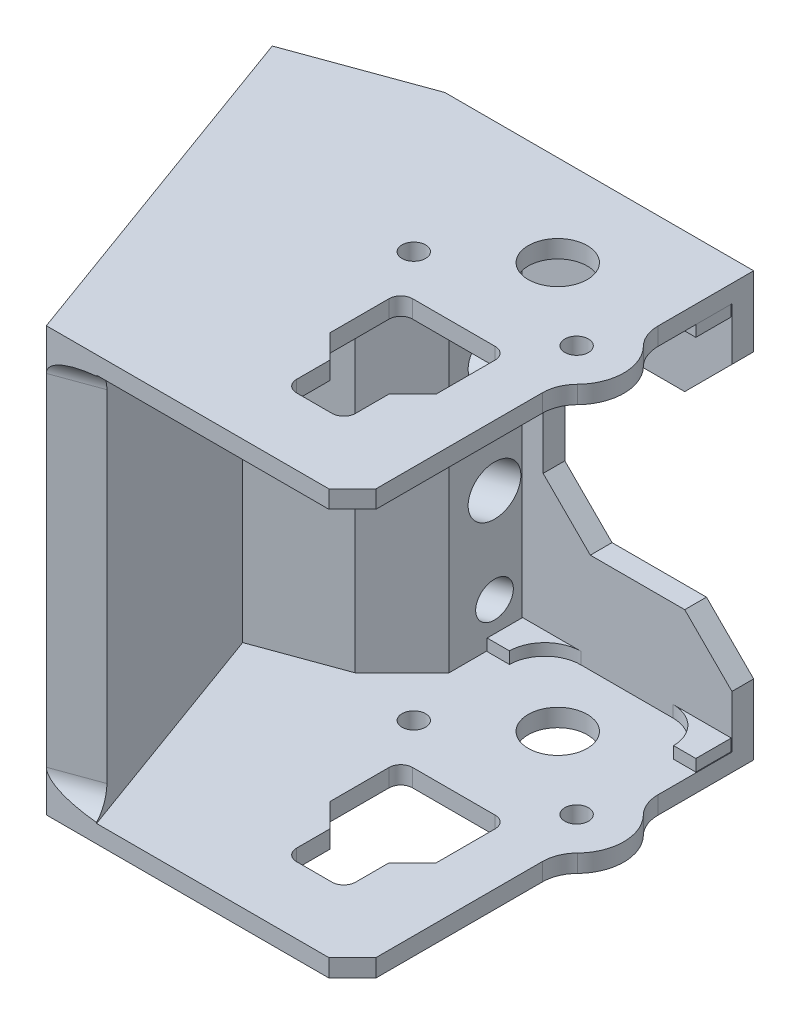
from build123d import *

# Parameters (mm, degrees)
SKETCH1_W                  = 17.8
SKETCH1_H                  = 30
SKETCH1_R                  = 1
SKETCH1_R_2                = 2.5
BOSS_EXTRUDE1_DEPTH        = 1.5
SKETCH2_W                  = 9
SKETCH2_H                  = 6
SKETCH2_W_2                = 5
SKETCH2_H_2                = 5.830943002
CUT_EXTRUDE1_DEPTH         = 20.247337478
CHAMFER1_SIZE              = 2
FILLET1_R                  = 1
BOSS_EXTRUDE2_DEPTH        = 1
SKETCH4_W                  = 12
SKETCH4_H                  = 17.95
BOSS_EXTRUDE3_DEPTH        = 4
BOSS_EXTRUDE4_DEPTH        = 35.9
SKETCH6_W                  = 12.770133269
SKETCH6_H                  = 35.9
BOSS_EXTRUDE5_DEPTH        = 11.41
F_3_0_MM_DOWEL_HOLES1_D    = 3
F_4_2_4_2_DIAMETER_HOLE1_D = 4.2
SKETCH12_W                 = 17.8
SKETCH12_H                 = 1.5
BOSS_EXTRUDE6_DEPTH        = 4
CHAMFER2_SIZE              = 2
SKETCH13_W                 = 26.167642811
SKETCH13_H                 = 35.9
BOSS_EXTRUDE7_DEPTH        = 1.840000002
CHAMFER3_SIZE              = 4
CHAMFER4_SIZE              = 4
SKETCH14_W                 = 16
SKETCH14_H                 = 8
CUT_EXTRUDE2_DEPTH         = 56.735892419
CHAMFER5_SIZE              = 4
BOSS_EXTRUDE8_DEPTH        = 1.5
BOSS_EXTRUDE9_START        = -34.4
BOSS_EXTRUDE9_DEPTH        = 1.5
FILLET2_R                  = 3
BOSS_EXTRUDE10_START       = -1.5
BOSS_EXTRUDE10_DEPTH       = 1.5
BOSS_EXTRUDE11_START       = -35.9
BOSS_EXTRUDE11_DEPTH       = 1.5
SKETCH18_W                 = 19.259010622
SKETCH18_H                 = 32.9
BOSS_EXTRUDE12_DEPTH       = 4
FILLET3_R                  = 2


# Some blends are built 0.0001 mm under size
with BuildPart() as part:
    # Sketch1 → Boss-Extrude1 (new body)
    with BuildSketch(Plane(origin=(0, 0, 0), x_dir=(1, 0, 0), z_dir=(0, 1, 0))):
        with Locations((0, -2)):
            Rectangle(SKETCH1_W, SKETCH1_H)
        with Locations(Location((-6.9, 0, 0), (0, 0, 270))):
            Circle(SKETCH1_R, mode=Mode.SUBTRACT)
        with Locations(Location((6.9, 0, 0), (0, 0, 270))):
            Circle(SKETCH1_R, mode=Mode.SUBTRACT)
        with Locations(Location((0, 5.3, 0), (0, 0, 270))):
            Circle(SKETCH1_R_2, mode=Mode.SUBTRACT)
    extrude(amount=BOSS_EXTRUDE1_DEPTH)

    # Sketch2 → Cut-Extrude1 (cut, through all)
    with BuildSketch(Plane(origin=(0, 1.5, 0), x_dir=(1, 0, 0), z_dir=(0, 1, 0))):
        with Locations((0, -6.5)):
            Rectangle(SKETCH2_W, SKETCH2_H)
        with Locations((0, -12.415471501)):
            Rectangle(SKETCH2_W_2, SKETCH2_H_2)
    extrude(amount=-CUT_EXTRUDE1_DEPTH, mode=Mode.SUBTRACT)

    # Chamfer1
    chamfer1_edges = [part.edges().sort_by_distance(p)[0] for p in [
        (2.5, 0.75, 9.5),
        (-2.5, 0.75, 9.5),
    ]]
    chamfer(chamfer1_edges, length=CHAMFER1_SIZE - 0.0001)  # a hair under: the kernel refuses the full size

    # Fillet1
    fillet1_edges = [part.edges().sort_by_distance(p)[0] for p in [
        (4.5, 0.75, 3.5),
        (2.5, 0.75, 15.330943002),
        (-2.5, 0.75, 15.330943002),
        (-4.5, 0.75, 3.5),
    ]]
    fillet(fillet1_edges, radius=FILLET1_R)

    # Sketch3 → Boss-Extrude2 (add)
    with BuildSketch(Plane(origin=(0, 1.5, 0), x_dir=(1, 0, 0), z_dir=(0, 1, 0))):
        with BuildLine():
            Line((8.84, 8.16), (6.959390471, 8.16))
            ThreePointArc((6.959390471, 8.16), (6.042112051, 10.284532913), (3.900010938, 11.159999998))
            Line((3.900010938, 11.159999998), (-3.900010938, 11.159999998))
            ThreePointArc((-3.900010938, 11.159999998), (-6.04211205, 10.284532912), (-6.959390471, 8.16))
            Line((-6.959390471, 8.16), (-8.84, 8.16))
            Line((-8.84, 8.16), (-8.84, 12.94))
            Line((-8.84, 12.94), (8.84, 12.94))
            Line((8.84, 12.94), (8.84, 8.16))
        make_face()
    extrude(amount=BOSS_EXTRUDE2_DEPTH)

    # Sketch4 → Boss-Extrude3 (add)
    with BuildSketch(Plane.ZY.offset(8.9)):
        with Locations((-7, 8.975)):
            Rectangle(SKETCH4_W, SKETCH4_H)
    extrude(amount=BOSS_EXTRUDE3_DEPTH)

    # Mirror2: part across plane


with BuildPart() as part_1:
    add(part.part)
    add(part.part.mirror(Plane.ZX.offset(17.95)))

    # Sketch5 → Boss-Extrude4 (add)
    with BuildSketch(Plane(origin=(0, 35.9, 0), x_dir=(1, 0, 0), z_dir=(0, 1, 0))):
        Polygon((-12.9, 1), (-17.267642811, 13), (-12.9, 13), align=None)
    extrude(amount=-BOSS_EXTRUDE4_DEPTH)

    # Sketch6 → Boss-Extrude5 (add)
    with BuildSketch(Plane(origin=(-11.069592853, 0, 4.029002304), x_dir=(0.3420201433256634, 0, 0.9396926207859103), z_dir=(-0.9396926207859103, 0, 0.3420201433256634))):
        with Locations((-11.736819105, 17.95)):
            Rectangle(SKETCH6_W, SKETCH6_H)
    extrude(amount=BOSS_EXTRUDE5_DEPTH)

    # Ø3.0 mm Dowel Holes1 (through all)
    with Locations(Plane(origin=(-23.72675034, 0, 2.614356121), x_dir=(-0.34202014332566333, 0, -0.9396926207859103), z_dir=(-0.9396926207859104, 0, 0.3420201433256634))):
        with Locations((5.693417073, -4.95), (5.693417073, -30.95)):
            Hole(F_3_0_MM_DOWEL_HOLES1_D / 2)

    # Ø4.2 (4.2) Diameter Hole1 (through all)
    with Locations(Plane(origin=(-21.791485656, 0, 7.931452139), x_dir=(0.34202014332566333, 0, 0.9396926207859103), z_dir=(-0.9396926207859104, 0, 0.3420201433256634))):
        with Locations((-11.35175247, 12.95), (-11.35175247, 22.95)):
            Hole(F_4_2_4_2_DIAMETER_HOLE1_D / 2)

    # Sketch12 → Boss-Extrude6 (add)
    with BuildSketch(Plane.XY.offset(17)):
        with Locations((0, 35.15)):
            Rectangle(SKETCH12_W, SKETCH12_H)
        with Locations((0, 0.75)):
            Rectangle(SKETCH12_W, SKETCH12_H)
    extrude(amount=BOSS_EXTRUDE6_DEPTH)

    # Chamfer2
    chamfer2_edges = [part_1.edges().sort_by_distance(p)[0] for p in [
        (8.9, 35.15, 21),
        (-8.9, 35.15, 21),
        (-8.9, 0.75, 21),
        (8.9, 0.75, 21),
    ]]
    chamfer(chamfer2_edges, length=CHAMFER2_SIZE)

    # Sketch13 → Boss-Extrude7 (add)
    with BuildSketch(Plane(origin=(0, 0, -13), x_dir=(-1, 0, 0), z_dir=(0, 0, -1))):
        with Locations((4.183821406, 17.95)):
            Rectangle(SKETCH13_W, SKETCH13_H)
    extrude(amount=-BOSS_EXTRUDE7_DEPTH)

    # Chamfer3
    # the kernel refuses this chamfer: 4 mm, written as the material it adds along each edge
    with BuildSketch(Plane(origin=(-8.9, 0, -1), x_dir=(-0.9996219169112968, 0, -0.027495876610586216), z_dir=(0, 1, 0)), Plane(origin=(-8.9, 35.9, -1), x_dir=(0.027495876610586924, 0, 0.9996219169112968), z_dir=(0, -1, 0))) as chamfer3_piece_1:
        Polygon((CHAMFER3_SIZE * 0.999621916911, CHAMFER3_SIZE * 0.0274958766106), (-CHAMFER3_SIZE * 0.0274958766106, CHAMFER3_SIZE * 0.999621916911), (0, 0), align=None)
    extrude(amount=1.5)

    # Chamfer4
    chamfer4_edges = [part_1.edges().sort_by_distance(p)[0] for p in [
        (-8.9, 17.95, -1),
    ]]
    chamfer(chamfer4_edges, length=CHAMFER4_SIZE - 0.0001)  # a hair under: the kernel refuses the full size

    # Sketch14 → Cut-Extrude2 (cut, through all)
    with BuildSketch(Plane.XY.offset(-11.159999998)):
        with Locations((0.9, 21.95)):
            Rectangle(SKETCH14_W, SKETCH14_H)
        with Locations((0.9, 13.95)):
            Rectangle(SKETCH14_W, SKETCH14_H)
    extrude(amount=-CUT_EXTRUDE2_DEPTH, mode=Mode.SUBTRACT)

    # Chamfer5
    chamfer5_edges = [part_1.edges().sort_by_distance(p)[0] for p in [
        (-7.1, 9.95, -12.079999999),
        (-7.1, 25.95, -12.079999999),
        (8.9, 25.95, -12.079999999),
        (8.9, 9.95, -12.079999999),
    ]]
    chamfer(chamfer5_edges, length=CHAMFER5_SIZE)

    # Sketch15 → Boss-Extrude8 (add)
    with BuildSketch(Plane.XZ):
        with BuildLine():
            Line((8.9, 3.464101615), (8.9, -3.464101615))
            ThreePointArc((8.9, -3.464101615), (10.9, 0), (8.9, 3.464101615))
        make_face()
    extrude(amount=-BOSS_EXTRUDE8_DEPTH)

    # Sketch15<2> → Boss-Extrude9 (add)
    with BuildSketch(Plane.XZ.offset(BOSS_EXTRUDE9_START)):
        with BuildLine():
            Line((8.9, 3.464101615), (8.9, -3.464101615))
            ThreePointArc((8.9, -3.464101615), (10.9, 0), (8.9, 3.464101615))
        make_face()
    extrude(amount=-BOSS_EXTRUDE9_DEPTH)

    # Fillet2
    fillet2_edges = [part_1.edges().sort_by_distance(p)[0] for p in [
        (-12.9, 0.75, -1),
        (-12.9, 35.15, -1),
        (-8.9, 0.75, 3),
        (-8.9, 35.15, 3),
        (8.9, 0.75, -3.464101615),
        (8.9, 0.75, 3.464101615),
        (8.9, 35.15, 3.464101615),
        (8.9, 35.15, -3.464101615),
    ]]
    fillet(fillet2_edges, radius=FILLET2_R)

    # Sketch16 → Boss-Extrude10 (add)
    with BuildSketch(Plane(origin=(0, 35.9, 0), x_dir=(1, 0, 0), z_dir=(0, 1, 0)).offset(BOSS_EXTRUDE10_START)):
        with BuildLine():
            Line((-8.9, -4.242640687), (-8.9, -19))
            Line((-8.9, -19), (-6.9, -21))
            Line((-6.9, -21), (-17.03492323, -21))
            Line((-17.03492323, -21), (-23.621892803, -2.902449835))
            Line((-23.621892803, -2.902449835), (-14.695950669, 0.346327414))
            ThreePointArc((-14.695950669, 0.346327414), (-13.020571397, 0.456137573), (-11.548569895, -0.351430105))
            Line((-11.548569895, -0.351430105), (-9.778679656, -2.121320344))
            ThreePointArc((-9.778679656, -2.121320344), (-9.128361402, -3.09459039), (-8.9, -4.242640687))
        make_face()
    extrude(amount=BOSS_EXTRUDE10_DEPTH)

    # Sketch16<2> → Boss-Extrude11 (add)
    with BuildSketch(Plane(origin=(0, 35.9, 0), x_dir=(1, 0, 0), z_dir=(0, 1, 0)).offset(BOSS_EXTRUDE11_START)):
        with BuildLine():
            Line((-8.9, -4.242640687), (-8.9, -19))
            Line((-8.9, -19), (-6.9, -21))
            Line((-6.9, -21), (-17.03492323, -21))
            Line((-17.03492323, -21), (-23.621892803, -2.902449835))
            Line((-23.621892803, -2.902449835), (-14.695950669, 0.346327414))
            ThreePointArc((-14.695950669, 0.346327414), (-13.020571397, 0.456137573), (-11.548569895, -0.351430105))
            Line((-11.548569895, -0.351430105), (-9.778679656, -2.121320344))
            ThreePointArc((-9.778679656, -2.121320344), (-9.128361402, -3.09459039), (-8.9, -4.242640687))
        make_face()
    extrude(amount=BOSS_EXTRUDE11_DEPTH)

    # Sketch18 → Boss-Extrude12 (add)
    with BuildSketch(Plane(origin=(-21.791485656, 0, 7.931452139), x_dir=(0.34202014332566333, 0, 0.9396926207859103), z_dir=(-0.9396926207859104, 0, 0.3420201433256634))):
        with Locations((4.277752841, 17.95)):
            Rectangle(SKETCH18_W, SKETCH18_H)
    extrude(amount=-BOSS_EXTRUDE12_DEPTH)

    # Fillet3
    # the kernel refuses this fillet: 2 mm, written as the material it adds along each edge
    with BuildSketch(Plane(origin=(-21.733386334, 34.4, 22.710100717), x_dir=(0.3420201433256634, 0, 0.9396926207859104), z_dir=(0.9396926207859104, 0, -0.3420201433256634))) as fillet3_piece_1_section:
        with BuildLine():
            CenterArc((FILLET3_R, FILLET3_R), FILLET3_R, 180, 90)
            Line((0, FILLET3_R), (0, 0))
            Line((0, 0), (FILLET3_R, 0))
        make_face()
    fillet3_piece_1 = extrude(amount=9, mode=Mode.PRIVATE)
    fillet3_piece_1 = split(fillet3_piece_1, bisect_by=Plane(origin=(-14.648893953, 33.872369462, 21), z_dir=(0, 0, -1)), keep=Keep.TOP, mode=Mode.PRIVATE)
    add(fillet3_piece_1)
    with BuildSketch(Plane(origin=(-21.733386334, 1.5, 22.710100717), x_dir=(0, 1, 0), z_dir=(0.9396926207859104, 0, -0.3420201433256634))) as fillet3_piece_2_section:
        with BuildLine():
            CenterArc((FILLET3_R, FILLET3_R), FILLET3_R, 180, 90)
            Line((0, FILLET3_R), (0, 0))
            Line((0, 0), (FILLET3_R, 0))
        make_face()
    fillet3_piece_2 = extrude(amount=9, mode=Mode.PRIVATE)
    fillet3_piece_2 = split(fillet3_piece_2, bisect_by=Plane(origin=(-14.648893954, 2.027630538, 21), z_dir=(0, 0, -1)), keep=Keep.TOP, mode=Mode.PRIVATE)
    add(fillet3_piece_2)


solid = part_1.part
